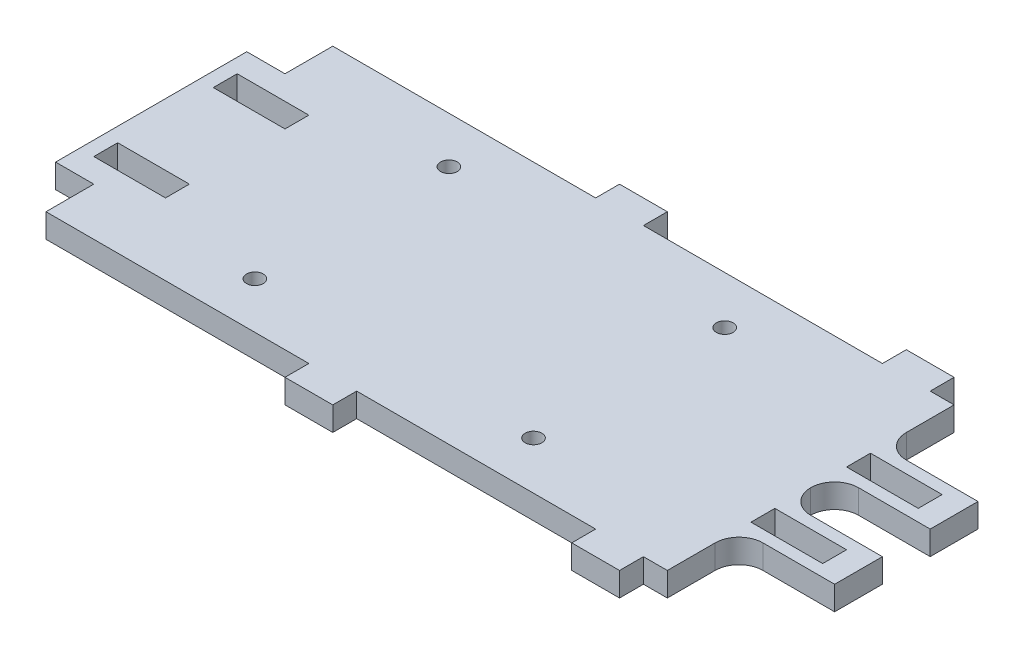
from build123d import *

# Parameters (mm, degrees)
SKETCH1_R           = 1.75
SKETCH1_W           = 15
SKETCH1_H           = 5
BOSS_EXTRUDE1_DEPTH = 5
FILLET1_R           = 5


with BuildPart() as part:
    # Sketch1 → Boss-Extrude1 (new body)
    with BuildSketch(Plane(origin=(0, 0, 0), x_dir=(1, 0, 0), z_dir=(0, 1, 0))):
        Polygon((65, 15), (65, 30), (60, 30), (60, 35), (50, 35), (50, 30), (0, 30), (0, 35), (-10, 35), (-10, 30), (-65, 30), (-65, 20), (-72.992352801, 20), (-72.992352801, 5), (-72.992352801, -5), (-72.992352801, -20), (-65, -20), (-65, -30), (-10, -30), (-10, -35), (0, -35), (0, -30), (50, -30), (50, -35), (60, -35), (60, -30), (65, -30), (65, -15), (85, -15), (85, -5), (65, -5), (65, 5), (85, 5), (85, 15), align=None)
        with Locations(Location((27, 20, 0), (0, 0, 270))):
            Circle(SKETCH1_R, mode=Mode.SUBTRACT)
        with Locations(Location((27, -20, 0), (0, 0, 270))):
            Circle(SKETCH1_R, mode=Mode.SUBTRACT)
        with Locations(Location((-31, 20.3, 0), (0, 0, 270))):
            Circle(SKETCH1_R, mode=Mode.SUBTRACT)
        with Locations(Location((-31, -20.3, 0), (0, 0, 270))):
            Circle(SKETCH1_R, mode=Mode.SUBTRACT)
        with Locations((72.5, 10)):
            Rectangle(SKETCH1_W, SKETCH1_H, mode=Mode.SUBTRACT)
        with Locations((72.5, -10)):
            Rectangle(SKETCH1_W, SKETCH1_H, mode=Mode.SUBTRACT)
        with Locations((-62.5, 12.5)):
            Rectangle(SKETCH1_W, SKETCH1_H, mode=Mode.SUBTRACT)
        with Locations((-62.5, -12.5)):
            Rectangle(SKETCH1_W, SKETCH1_H, mode=Mode.SUBTRACT)
    extrude(amount=BOSS_EXTRUDE1_DEPTH)

    # Fillet1
    fillet1_edges = [part.edges().sort_by_distance(p)[0] for p in [
        (65, 2.5, -15),
        (65, 2.5, -5),
        (65, 2.5, 5),
        (65, 2.5, 15),
    ]]
    fillet(fillet1_edges, radius=FILLET1_R - 0.0001)  # a hair under: the kernel refuses the full size


solid = part.part
